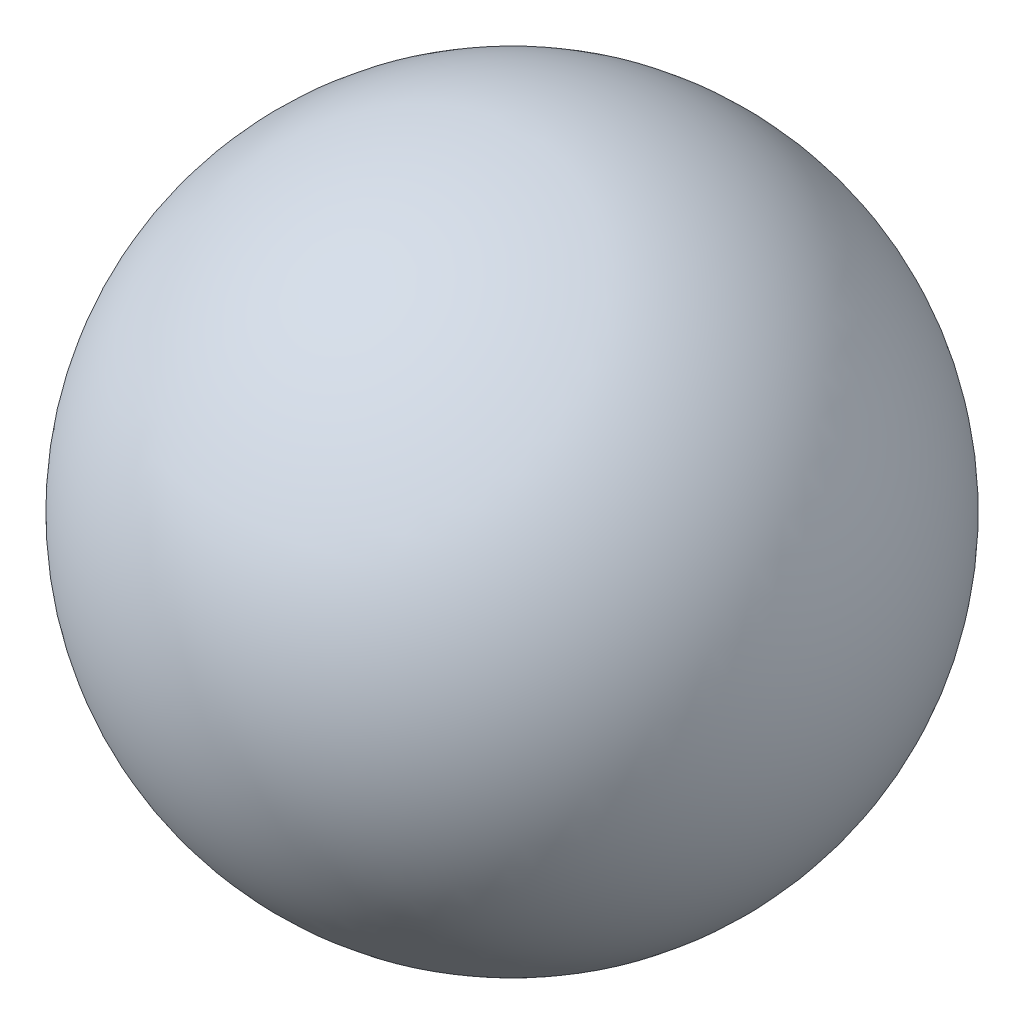
from build123d import *


# Read off the part's stored shape, not the designer's step: Bill Native-19-surface1
with BuildPart() as part:
    # Sketch2 → Revolve1 (revolve)
    with BuildSketch(Plane.XY.offset(-101.560140548)):
        with BuildLine():
            Line((-5.440707742, 356.111456267), (-5.440707742, 312.111456267))
            ThreePointArc((-5.440707742, 312.111456267), (-27.440707742, 334.111456267), (-5.440707742, 356.111456267))
        make_face()
    revolve(axis=Axis((-5.440707742, 356.111456267, -101.560140548), (0, -1, 0)))


solid = part.part
